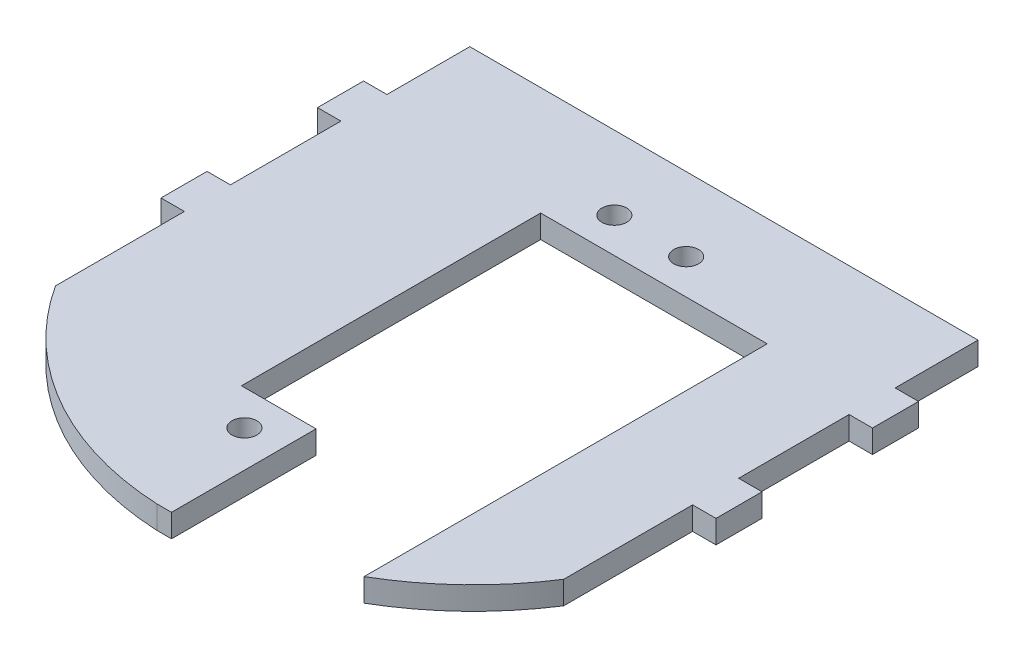
from build123d import *

# Parameters (mm, degrees)
SKETCH1_W              = 70.104
SKETCH1_H              = 50.8
RECTANGULAR_BASE_DEPTH = 3.175
SKETCH4_W              = 3.2258
SKETCH4_H              = 6.35
TAB_DEPTH              = 3.175
SKETCH8_W              = 70.104
SKETCH8_H              = 25.4
BOSS_EXTRUDE2_DEPTH    = 3.175
CUT_EXTRUDE2_OUTLINE_R = 1.7145
CUT_EXTRUDE2_OUTLINE_W = 20.586
CUT_EXTRUDE2_OUTLINE_H = 41.275
CUT_EXTRUDE2_DEPTH     = 3.175
CUT_EXTRUDE3_DEPTH     = 64.686031419
CUT_EXTRUDE4_DEPTH     = 64.686031419


# Read off the part's stored shape, not the designer's step: Cut-Extrude2
with BuildPart() as part:
    # Sketch1 → rectangular base (new body)
    with BuildSketch(Plane(origin=(0, 0, 0), x_dir=(1, 0, 0), z_dir=(0, 1, 0))):
        Rectangle(SKETCH1_W, SKETCH1_H)
    extrude(amount=RECTANGULAR_BASE_DEPTH)

    # Sketch4 → tab (add)
    with BuildSketch(Plane(origin=(0, 3.175, 0), x_dir=(1, 0, 0), z_dir=(0, 1, 0))):
        with Locations((-36.6649, 10.795)):
            Rectangle(SKETCH4_W, SKETCH4_H)
        with Locations((-36.6649, -10.795)):
            Rectangle(SKETCH4_W, SKETCH4_H)
    tab = extrude(amount=-TAB_DEPTH)

    # Mirror1: tab across plane
    add(tab.mirror(Plane(origin=(0, 0, 0), x_dir=(0, 0, 1), z_dir=(1, 0, 0))))

    # Sketch8 → Boss-Extrude2 (add)
    with BuildSketch(Plane(origin=(0, 3.175, 0), x_dir=(1, 0, 0), z_dir=(0, 1, 0))):
        with Locations((0, -38.1)):
            Rectangle(SKETCH8_W, SKETCH8_H)
    extrude(amount=-BOSS_EXTRUDE2_DEPTH)

    # Cut-Extrude2 outline → Cut-Extrude2 (cut)
    with BuildSketch(Plane(origin=(0, 0, 0), x_dir=(1, 0, 0), z_dir=(0, 1, 0))):
        with Locations((4.955, 15.24)):
            Circle(CUT_EXTRUDE2_OUTLINE_R)
        with Locations((-4.955, 15.24)):
            Circle(CUT_EXTRUDE2_OUTLINE_R)
        with Locations((4.853793359, -35.687)):
            Circle(CUT_EXTRUDE2_OUTLINE_R)
        with Locations((-5.056206641, -35.687)):
            Circle(CUT_EXTRUDE2_OUTLINE_R)
        with Locations((0, -10.2235)):
            Rectangle(CUT_EXTRUDE2_OUTLINE_W, CUT_EXTRUDE2_OUTLINE_H)
    extrude(amount=CUT_EXTRUDE2_DEPTH, mode=Mode.SUBTRACT)

    # Sketch9 → Cut-Extrude3 (cut, through all)
    with BuildSketch(Plane(origin=(0, 3.175, 0), x_dir=(1, 0, 0), z_dir=(0, 1, 0))):
        Polygon((0, -30.861), (0, -50.8), (10.293, -50.8), (20.961, -50.8), (20.961, 10.414), (10.293, 10.414), (10.293, -30.861), align=None)
    extrude(amount=-CUT_EXTRUDE3_DEPTH, mode=Mode.SUBTRACT)

    # Sketch10 → Cut-Extrude4 (cut, through all)
    with BuildSketch(Plane(origin=(0, 3.175, 0), x_dir=(1, 0, 0), z_dir=(0, 1, 0))):
        with BuildLine():
            Line((-35.052, -31.75), (-35.052, -60.151970588))
            Line((-35.052, -60.151970588), (35.052, -60.151970588))
            Line((35.052, -60.151970588), (35.052, -31.75))
            ThreePointArc((35.052, -31.75), (0, -50.84891964), (-35.052, -31.75))
        make_face()
    extrude(amount=-CUT_EXTRUDE4_DEPTH, mode=Mode.SUBTRACT)


solid = part.part
